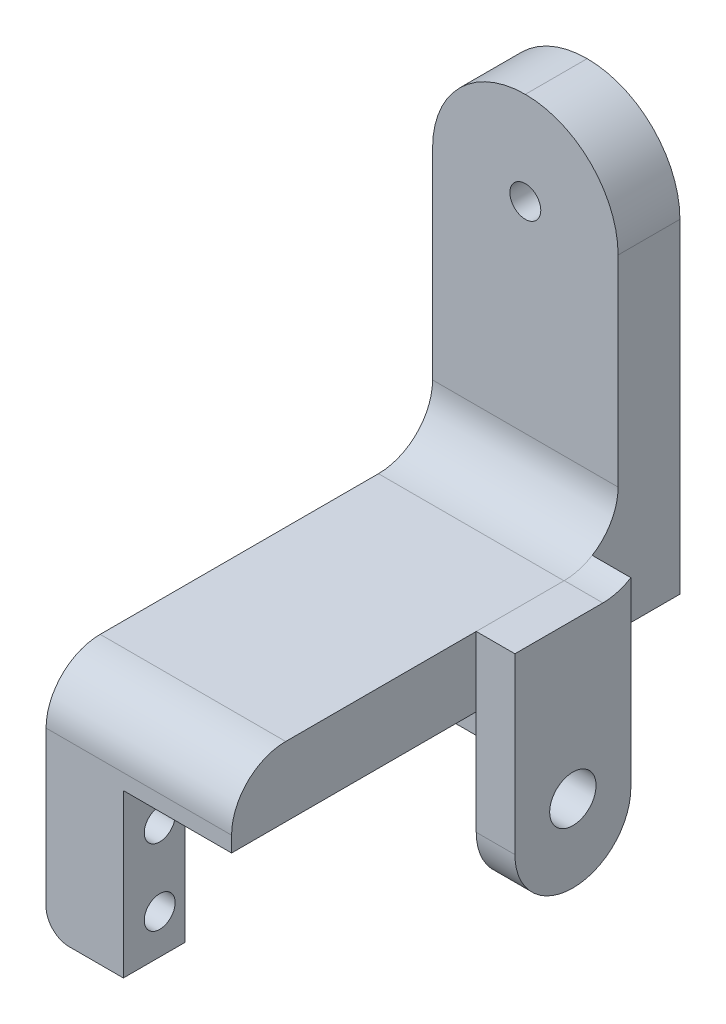
from build123d import *

# Parameters (mm, degrees)
SKETCH2_W           = 24
SKETCH2_H           = 75
BOSS_EXTRUDE1_DEPTH = 8
FILLET1_R           = 12
SKETCH3_W           = 24.000000014
SKETCH3_H           = 30
BOSS_EXTRUDE2_DEPTH = 50
SKETCH4_W           = 42
SKETCH4_H           = 27.227537437
CUT_EXTRUDE1_DEPTH  = 24
FILLET2_R           = 7
CUT_EXTRUDE3_DEPTH  = 14
SKETCH6_R           = 3
BOSS_EXTRUDE3_DEPTH = 5
FILLET3_R           = 3
SKETCH7_R           = 2
CUT_EXTRUDE4_DEPTH  = 102.473144681
SKETCH8_R           = 3
CUT_EXTRUDE5_DEPTH  = 4
SKETCH9_R           = 2
CUT_EXTRUDE6_DEPTH  = 10
FILLET4_R           = 7.5


# Some blends are built 0.0001 mm under size
with BuildPart() as part:
    # Sketch2 → Boss-Extrude1 (new body)
    with BuildSketch(Plane(origin=(0, -0.00023232, -27.997849314), x_dir=(1.0, -2.2299085471311813e-10, 0), z_dir=(-1.0101845712424022e-15, -8.29778911543011e-06, -0.9999999999655734))):
        with Locations((57.195219243, 10.372982491)):
            Rectangle(SKETCH2_W, SKETCH2_H)
    extrude(amount=BOSS_EXTRUDE1_DEPTH)

    # Fillet1
    # the kernel refuses this fillet: 12 mm, written as the material it takes off along each edge
    with BuildSketch(Plane(origin=(45.195219249, 27.127034112, 2.001925591), x_dir=(1.0, -2.229911070638136e-10, 0), z_dir=(-1.0101845712424022e-15, -8.29778911543011e-06, -0.9999999999655734))) as fillet1_piece_1:
        with BuildLine():
            CenterArc((FILLET1_R, FILLET1_R), FILLET1_R, 180, 90)
            Line((0, FILLET1_R), (0, 0))
            Line((0, 0), (FILLET1_R, 0))
        make_face()
    extrude(amount=68, mode=Mode.SUBTRACT)
    with BuildSketch(Plane(origin=(69.195219249, 27.127034106, 2.001925591), x_dir=(-1.0, 2.229905149399539e-10, 0), z_dir=(-1.0101845712424022e-15, -8.29778911543011e-06, -0.9999999999655734))) as fillet1_piece_2:
        with BuildLine():
            CenterArc((FILLET1_R, -FILLET1_R), FILLET1_R, 90, 90)
            Line((0, -FILLET1_R), (0, 0))
            Line((0, 0), (FILLET1_R, 0))
        make_face()
    extrude(amount=68, mode=Mode.SUBTRACT)

    # Sketch3 → Boss-Extrude2 (add)
    with BuildSketch(Plane(origin=(0, -0.00023232, -27.997849314), x_dir=(1, 0, 0), z_dir=(0, 8.297789115425485e-06, 0.9999999999655734))):
        with Locations((57.19521924, -32.872982501)):
            Rectangle(SKETCH3_W, SKETCH3_H)
    extrude(amount=BOSS_EXTRUDE2_DEPTH)

    # Sketch4 → Cut-Extrude1 (cut)
    with BuildSketch(Plane(origin=(69.195219243, -1.5e-08, 0), x_dir=(0, 0, -1), z_dir=(1.0, -2.2299088501705893e-10, 0))):
        with Locations((6.99770101, -40.486956155)):
            Rectangle(SKETCH4_W, SKETCH4_H)
    extrude(amount=-CUT_EXTRUDE1_DEPTH, mode=Mode.SUBTRACT)

    # Fillet2
    fillet2_edges = [part.edges().sort_by_distance(p)[0] for p in [
        (57.19521924, -17.87321482, -27.997701008),
        (57.19521924, -17.872799931, 22.002298991),
    ]]
    fillet(fillet2_edges, radius=FILLET2_R)

    # Sketch5 → Cut-Extrude3 (cut)
    with BuildSketch(Plane(origin=(69.195219243, -1.5e-08, 0), x_dir=(0, 0, -1), z_dir=(1.0, -2.2299088501705893e-10, 0))):
        Polygon((-22.002373674, -26.873187436), (-22.002547924, -47.872799915), (35.997452074, -47.873281192), (35.997626328, -26.873187436), align=None)
    extrude(amount=-CUT_EXTRUDE3_DEPTH, mode=Mode.SUBTRACT)

    # Sketch6 → Boss-Extrude3 (add)
    with BuildSketch(Plane(origin=(69.195219243, -1.5e-08, 0), x_dir=(0, 0, -1), z_dir=(1.0, -2.2299088501705893e-10, 0))):
        with BuildLine():
            Line((21.034070668, -17.873062539), (9.647551643, -17.873062539))
            Line((9.647551643, -17.873062539), (9.647551643, -47.873062539))
            Line((9.647551643, -47.873062539), (24.647551644, -47.873187436))
            Line((24.647551644, -47.873187436), (24.647551644, -16.846348023))
            ThreePointArc((24.647551644, -16.846348023), (22.910970159, -17.606627105), (21.034070668, -17.873062539))
        make_face()
        with Locations(Location((17.147551644, -37.873187436, 0), (0, 0, 270))):
            Circle(SKETCH6_R, mode=Mode.SUBTRACT)
    extrude(amount=BOSS_EXTRUDE3_DEPTH)

    # Fillet3
    fillet3_edges = [part.edges().sort_by_distance(p)[0] for p in [
        (45.195219233, -47.872833122, 18.002423457),
        (45.195219233, -47.873248012, -31.997576542),
    ]]
    fillet(fillet3_edges, radius=FILLET3_R)

    # Sketch7 → Cut-Extrude4 (cut, through all)
    with BuildSketch(Plane(origin=(0, -0.00023232, -27.997849314), x_dir=(1, 0, 0), z_dir=(0, 8.297789115402354e-06, 0.9999999999655734))):
        with Locations(Location((57.195219247, 15.127017497, 0), (0, 0, 270))):
            Circle(SKETCH7_R)
    extrude(amount=-CUT_EXTRUDE4_DEPTH, mode=Mode.SUBTRACT)

    # Sketch8 → Cut-Extrude5 (cut)
    with BuildSketch(Plane(origin=(0, -0.000298703, -35.997849314), x_dir=(-1, 0, 0), z_dir=(0, -8.297789115402354e-06, -0.9999999999655734))):
        with Locations(Location((-57.195219247, 15.127017497, 0), (0, 0, 90))):
            Circle(SKETCH8_R)
    extrude(amount=-CUT_EXTRUDE5_DEPTH, mode=Mode.SUBTRACT)

    # Sketch9 → Cut-Extrude6 (cut)
    with BuildSketch(Plane(origin=(55.195219243, -1.2e-08, 0), x_dir=(0, 0, -1), z_dir=(1.0, -2.2299126401379802e-10, 0))):
        with Locations(Location((31.29770101, -42.773187436, 0), (0, 0, 90))):
            Circle(SKETCH9_R)
        with Locations(Location((31.29770101, -32.973187436, 0), (0, 0, 90))):
            Circle(SKETCH9_R)
        with Locations(Location((-17.30229899, -42.773187436, 0), (0, 0, 90))):
            Circle(SKETCH9_R)
        with Locations(Location((-17.30229899, -32.973187436, 0), (0, 0, 90))):
            Circle(SKETCH9_R)
    extrude(amount=-CUT_EXTRUDE6_DEPTH, mode=Mode.SUBTRACT)

    # Fillet4
    fillet4_edges = [part.edges().sort_by_distance(p)[0] for p in [
        (71.695219233, -47.873187452, -24.647551644),
        (71.695219233, -47.873062555, -9.647551643),
    ]]
    fillet(fillet4_edges, radius=FILLET4_R - 0.0001)  # a hair under: the kernel refuses the full size


solid = part.part
